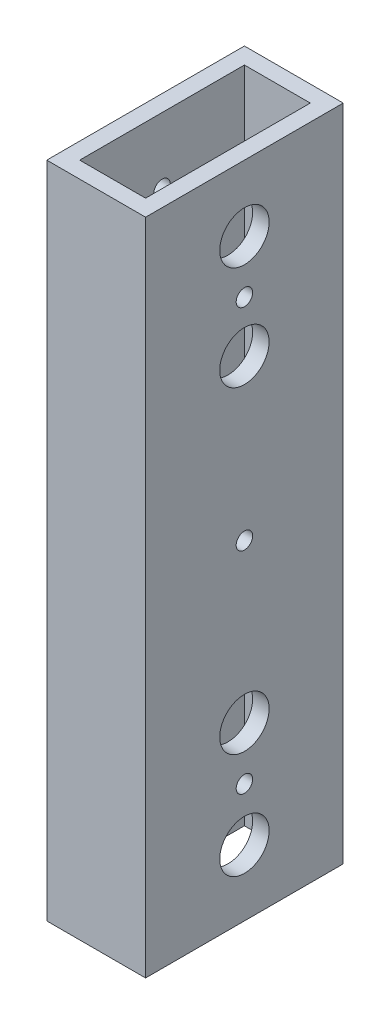
from build123d import *

# Parameters (mm, degrees)
SKETCH1_W           = 19.05
SKETCH1_H           = 38.1
SKETCH1_W_2         = 12.7
SKETCH1_H_2         = 31.75
BOSS_EXTRUDE1_DEPTH = 127
SKETCH2_R           = 1.5875
CUT_EXTRUDE1_DEPTH  = 134.953396747
CUT_EXTRUDE2_REACH  = 135.953
SKETCH3_R           = 4.7625
SKETCH4_R           = 1.5875
CUT_EXTRUDE3_DEPTH  = 134.953396747
CUT_EXTRUDE4_REACH  = 135.953
SKETCH5_R           = 4.7625


with BuildPart() as part:
    # Sketch1 → Boss-Extrude1 (new body)
    with BuildSketch(Plane(origin=(0, 0, 0), x_dir=(1, 0, 0), z_dir=(0, 1, 0))):
        with Locations((9.525, 19.05)):
            Rectangle(SKETCH1_W, SKETCH1_H)
        with Locations((9.525, 19.05)):
            Rectangle(SKETCH1_W_2, SKETCH1_H_2, mode=Mode.SUBTRACT)
    extrude(amount=BOSS_EXTRUDE1_DEPTH)

    # Sketch2 → Cut-Extrude1 (cut, through all)
    with BuildSketch(Plane(origin=(19.05, 0, 0), x_dir=(0, 0, -1), z_dir=(1, 0, 0))):
        with Locations((19.05, 12.7)):
            Circle(SKETCH2_R)
        with Locations((19.05, 32.69996)):
            Circle(SKETCH2_R)
        with Locations((19.05, 94.30004)):
            Circle(SKETCH2_R)
        with Locations((19.05, 114.3)):
            Circle(SKETCH2_R)
    extrude(amount=-CUT_EXTRUDE1_DEPTH, mode=Mode.SUBTRACT)

    # Sketch3 → Cut-Extrude2 (cut, up to next)
    with BuildSketch(Plane(origin=(19.05, 0, 0), x_dir=(0, 0, -1), z_dir=(1, 0, 0)), mode=Mode.PRIVATE) as cut_extrude2_sk1:
        with Locations((19.05, 114.3)):
            Circle(SKETCH3_R)
    cut_extrude2_tool1 = extrude(cut_extrude2_sk1.sketch, amount=-CUT_EXTRUDE2_REACH, mode=Mode.PRIVATE) & part.part
    # Sketch3 → Cut-Extrude2 (cut, up to next)
    with BuildSketch(Plane(origin=(19.05, 0, 0), x_dir=(0, 0, -1), z_dir=(1, 0, 0)), mode=Mode.PRIVATE) as cut_extrude2_sk2:
        with Locations((19.05, 94.30004)):
            Circle(SKETCH3_R)
    cut_extrude2_tool2 = extrude(cut_extrude2_sk2.sketch, amount=-CUT_EXTRUDE2_REACH, mode=Mode.PRIVATE) & part.part
    # Sketch3 → Cut-Extrude2 (cut, up to next)
    with BuildSketch(Plane(origin=(19.05, 0, 0), x_dir=(0, 0, -1), z_dir=(1, 0, 0)), mode=Mode.PRIVATE) as cut_extrude2_sk3:
        with Locations((19.05, 33.059408242)):
            Circle(SKETCH3_R)
    cut_extrude2_tool3 = extrude(cut_extrude2_sk3.sketch, amount=-CUT_EXTRUDE2_REACH, mode=Mode.PRIVATE) & part.part
    # Sketch3 → Cut-Extrude2 (cut, up to next)
    with BuildSketch(Plane(origin=(19.05, 0, 0), x_dir=(0, 0, -1), z_dir=(1, 0, 0)), mode=Mode.PRIVATE) as cut_extrude2_sk4:
        with Locations((19.05, 12.7)):
            Circle(SKETCH3_R)
    cut_extrude2_tool4 = extrude(cut_extrude2_sk4.sketch, amount=-CUT_EXTRUDE2_REACH, mode=Mode.PRIVATE) & part.part
    add(cut_extrude2_tool1.solids().sort_by_distance((19.05, 114.3, -19.05))[0], mode=Mode.SUBTRACT)
    add(cut_extrude2_tool2.solids().sort_by_distance((19.05, 94.30004, -19.05))[0], mode=Mode.SUBTRACT)
    add(cut_extrude2_tool3.solids().sort_by_distance((19.05, 33.059408, -19.05))[0], mode=Mode.SUBTRACT)
    add(cut_extrude2_tool4.solids().sort_by_distance((19.05, 12.7, -19.05))[0], mode=Mode.SUBTRACT)

    # Sketch4 → Cut-Extrude3 (cut, through all)
    with BuildSketch(Plane(origin=(19.05, 0, 0), x_dir=(0, 0, -1), z_dir=(1, 0, 0))):
        with Locations((19.05, 22.879704121)):
            Circle(SKETCH4_R)
        with Locations((19.05, 63.5)):
            Circle(SKETCH4_R)
        with Locations((19.05, 104.120295879)):
            Circle(SKETCH4_R)
    extrude(amount=-CUT_EXTRUDE3_DEPTH, mode=Mode.SUBTRACT)

    # Sketch5 → Cut-Extrude4 (cut, up to next)
    with BuildSketch(Plane.ZY, mode=Mode.PRIVATE) as cut_extrude4_sk1:
        with Locations((-19.05, 104.120295879)):
            Circle(SKETCH5_R)
    cut_extrude4_tool1 = extrude(cut_extrude4_sk1.sketch, amount=-CUT_EXTRUDE4_REACH, mode=Mode.PRIVATE) & part.part
    # Sketch5 → Cut-Extrude4 (cut, up to next)
    with BuildSketch(Plane.ZY, mode=Mode.PRIVATE) as cut_extrude4_sk2:
        with Locations((-19.05, 63.5)):
            Circle(SKETCH5_R)
    cut_extrude4_tool2 = extrude(cut_extrude4_sk2.sketch, amount=-CUT_EXTRUDE4_REACH, mode=Mode.PRIVATE) & part.part
    # Sketch5 → Cut-Extrude4 (cut, up to next)
    with BuildSketch(Plane.ZY, mode=Mode.PRIVATE) as cut_extrude4_sk3:
        with Locations((-19.05, 22.879704121)):
            Circle(SKETCH5_R)
    cut_extrude4_tool3 = extrude(cut_extrude4_sk3.sketch, amount=-CUT_EXTRUDE4_REACH, mode=Mode.PRIVATE) & part.part
    add(cut_extrude4_tool1.solids().sort_by_distance((0, 104.120296, -19.05))[0], mode=Mode.SUBTRACT)
    add(cut_extrude4_tool2.solids().sort_by_distance((0, 63.5, -19.05))[0], mode=Mode.SUBTRACT)
    add(cut_extrude4_tool3.solids().sort_by_distance((0, 22.879704, -19.05))[0], mode=Mode.SUBTRACT)


solid = part.part
